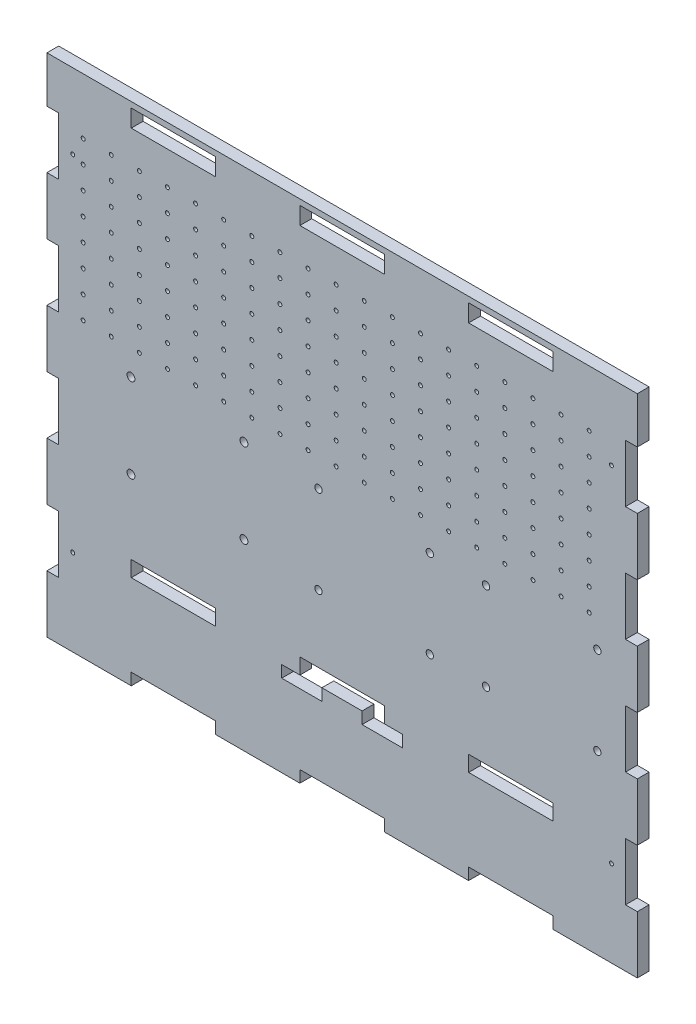
from build123d import *

# Parameters (mm, degrees)
SKETCH1_W                = 266.7
SKETCH1_H                = 223.52
BOSS_EXTRUDE1_DEPTH      = 5.334
SKETCH2_W                = 38.1
SKETCH2_H                = 5.334
CUT_EXTRUDE1_DEPTH       = 197.710659379
SKETCH5_W                = 38.1
SKETCH5_H                = 7.112
CUT_EXTRUDE3_DEPTH       = 197.710659379
SKETCH8_W                = 18.149934459
SKETCH8_H                = 5.334
SKETCH8_W_2              = 18.14993446
CUT_EXTRUDE6_DEPTH       = 197.710659379
SKETCH9_R                = 0.889
CUT_EXTRUDE7_DEPTH       = 197.710659379
SKETCH10_W               = 38.1
SKETCH10_H               = 5.334
BOSS_EXTRUDE2_DEPTH      = 10.16
BOSS_EXTRUDE3_DEPTH      = 76.2
BOSS_EXTRUDE3_DEPTH_BACK = 190.5
SKETCH12_W               = 5.334
SKETCH12_H               = 7.62
SKETCH13_W               = 38.1
SKETCH13_H               = 5.334
BOSS_EXTRUDE4_DEPTH      = 2.54
SKETCH14_W               = 38.1
SKETCH14_H               = 5.334
BOSS_EXTRUDE5_DEPTH      = 2.54
SKETCH15_W               = 38.1
SKETCH15_H               = 5.334
BOSS_EXTRUDE6_DEPTH      = 2.54
SKETCH16_W               = 5.334
SKETCH16_H               = 25.964444445
SKETCH16_H_2             = 25.964444444
CUT_EXTRUDE9_DEPTH       = 205.029793122
SKETCH17_R               = 1.651
CUT_EXTRUDE10_DEPTH      = 205.029793122
SKETCH18_R               = 0.889
CUT_EXTRUDE11_DEPTH      = 205.029793122
SKETCH19_R               = 1.778
CUT_EXTRUDE12_DEPTH      = 205.029793122
SKETCH20_W               = 266.7
SKETCH20_H               = 5.08
CUT_EXTRUDE13_DEPTH      = 205.029793122


with BuildPart() as part:
    # Sketch1 → Boss-Extrude1 (new body)
    with BuildSketch(Plane.XY):
        with Locations((5.474099752, 27.504142138)):
            Rectangle(SKETCH1_W, SKETCH1_H)
    extrude(amount=BOSS_EXTRUDE1_DEPTH)

    # Sketch2 → Cut-Extrude1 (cut, through all)
    with BuildSketch(Plane.XY.offset(5.334)):
        with Locations((-70.725900248, -81.588857862)):
            Rectangle(SKETCH2_W, SKETCH2_H)
        with Locations((5.474099752, -81.588857862)):
            Rectangle(SKETCH2_W, SKETCH2_H)
        with Locations((81.674099752, -81.588857862)):
            Rectangle(SKETCH2_W, SKETCH2_H)
        with Locations((81.674099752, 136.597142138)):
            Rectangle(SKETCH2_W, SKETCH2_H)
        with Locations((5.474099752, 136.597142138)):
            Rectangle(SKETCH2_W, SKETCH2_H)
        with Locations((-70.725900248, 136.597142138)):
            Rectangle(SKETCH2_W, SKETCH2_H)
    extrude(amount=-CUT_EXTRUDE1_DEPTH, mode=Mode.SUBTRACT)

    # Sketch5 → Cut-Extrude3 (cut, through all)
    with BuildSketch(Plane.XY.offset(5.334)):
        with Locations((-70.725900248, -38.378413173)):
            Rectangle(SKETCH5_W, SKETCH5_H)
        with Locations((5.474099752, -38.378413173)):
            Rectangle(SKETCH5_W, SKETCH5_H)
        with Locations((81.674099752, -38.378413173)):
            Rectangle(SKETCH5_W, SKETCH5_H)
    extrude(amount=-CUT_EXTRUDE3_DEPTH, mode=Mode.SUBTRACT)

    # Sketch8 → Cut-Extrude6 (cut, through all)
    with BuildSketch(Plane.XY.offset(5.334)):
        with Locations((-12.722736397, -44.601413173)):
            Rectangle(SKETCH8_W, SKETCH8_H)
        with Locations((23.577132522, -44.601413173)):
            Rectangle(SKETCH8_W_2, SKETCH8_H)
    extrude(amount=-CUT_EXTRUDE6_DEPTH, mode=Mode.SUBTRACT)

    # Sketch9 → Cut-Extrude7 (cut, through all)
    with BuildSketch(Plane.XY.offset(5.334)):
        with Locations((-111.514346632, 118.978930244)):
            Circle(SKETCH9_R)
        with Locations((-98.814346632, 118.978930244)):
            Circle(SKETCH9_R)
        with Locations((-86.114346632, 118.978930244)):
            Circle(SKETCH9_R)
        with Locations((-73.414346632, 118.978930244)):
            Circle(SKETCH9_R)
        with Locations((-60.714346632, 118.978930244)):
            Circle(SKETCH9_R)
        with Locations((-48.014346632, 118.978930244)):
            Circle(SKETCH9_R)
        with Locations((-35.314346632, 118.978930244)):
            Circle(SKETCH9_R)
        with Locations((-22.614346632, 118.978930244)):
            Circle(SKETCH9_R)
        with Locations((-9.914346632, 118.978930244)):
            Circle(SKETCH9_R)
        with Locations((2.785653368, 118.978930244)):
            Circle(SKETCH9_R)
        with Locations((15.485653368, 118.978930244)):
            Circle(SKETCH9_R)
        with Locations((28.185653368, 118.978930244)):
            Circle(SKETCH9_R)
        with Locations((40.885653368, 118.978930244)):
            Circle(SKETCH9_R)
        with Locations((53.585653368, 118.978930244)):
            Circle(SKETCH9_R)
        with Locations((66.285653368, 118.978930244)):
            Circle(SKETCH9_R)
        with Locations((78.985653368, 118.978930244)):
            Circle(SKETCH9_R)
        with Locations((91.685653368, 118.978930244)):
            Circle(SKETCH9_R)
        with Locations((104.385653368, 118.978930244)):
            Circle(SKETCH9_R)
        with Locations((117.085653368, 118.978930244)):
            Circle(SKETCH9_R)
        with Locations((-111.514346632, 108.818930244)):
            Circle(SKETCH9_R)
        with Locations((-98.814346632, 108.818930244)):
            Circle(SKETCH9_R)
        with Locations((-86.114346632, 108.818930244)):
            Circle(SKETCH9_R)
        with Locations((-73.414346632, 108.818930244)):
            Circle(SKETCH9_R)
        with Locations((-60.714346632, 108.818930244)):
            Circle(SKETCH9_R)
        with Locations((-48.014346632, 108.818930244)):
            Circle(SKETCH9_R)
        with Locations((-35.314346632, 108.818930244)):
            Circle(SKETCH9_R)
        with Locations((-22.614346632, 108.818930244)):
            Circle(SKETCH9_R)
        with Locations((-9.914346632, 108.818930244)):
            Circle(SKETCH9_R)
        with Locations((2.785653368, 108.818930244)):
            Circle(SKETCH9_R)
        with Locations((15.485653368, 108.818930244)):
            Circle(SKETCH9_R)
        with Locations((28.185653368, 108.818930244)):
            Circle(SKETCH9_R)
        with Locations((40.885653368, 108.818930244)):
            Circle(SKETCH9_R)
        with Locations((53.585653368, 108.818930244)):
            Circle(SKETCH9_R)
        with Locations((66.285653368, 108.818930244)):
            Circle(SKETCH9_R)
        with Locations((78.985653368, 108.818930244)):
            Circle(SKETCH9_R)
        with Locations((91.685653368, 108.818930244)):
            Circle(SKETCH9_R)
        with Locations((104.385653368, 108.818930244)):
            Circle(SKETCH9_R)
        with Locations((117.085653368, 108.818930244)):
            Circle(SKETCH9_R)
        with Locations((-111.514346632, 98.658930244)):
            Circle(SKETCH9_R)
        with Locations((-98.814346632, 98.658930244)):
            Circle(SKETCH9_R)
        with Locations((-86.114346632, 98.658930244)):
            Circle(SKETCH9_R)
        with Locations((-73.414346632, 98.658930244)):
            Circle(SKETCH9_R)
        with Locations((-60.714346632, 98.658930244)):
            Circle(SKETCH9_R)
        with Locations((-48.014346632, 98.658930244)):
            Circle(SKETCH9_R)
        with Locations((-35.314346632, 98.658930244)):
            Circle(SKETCH9_R)
        with Locations((-22.614346632, 98.658930244)):
            Circle(SKETCH9_R)
        with Locations((-9.914346632, 98.658930244)):
            Circle(SKETCH9_R)
        with Locations((2.785653368, 98.658930244)):
            Circle(SKETCH9_R)
        with Locations((15.485653368, 98.658930244)):
            Circle(SKETCH9_R)
        with Locations((28.185653368, 98.658930244)):
            Circle(SKETCH9_R)
        with Locations((40.885653368, 98.658930244)):
            Circle(SKETCH9_R)
        with Locations((53.585653368, 98.658930244)):
            Circle(SKETCH9_R)
        with Locations((66.285653368, 98.658930244)):
            Circle(SKETCH9_R)
        with Locations((78.985653368, 98.658930244)):
            Circle(SKETCH9_R)
        with Locations((91.685653368, 98.658930244)):
            Circle(SKETCH9_R)
        with Locations((104.385653368, 98.658930244)):
            Circle(SKETCH9_R)
        with Locations((117.085653368, 98.658930244)):
            Circle(SKETCH9_R)
        with Locations((-111.514346632, 88.498930244)):
            Circle(SKETCH9_R)
        with Locations((-98.814346632, 88.498930244)):
            Circle(SKETCH9_R)
        with Locations((-86.114346632, 88.498930244)):
            Circle(SKETCH9_R)
        with Locations((-73.414346632, 88.498930244)):
            Circle(SKETCH9_R)
        with Locations((-60.714346632, 88.498930244)):
            Circle(SKETCH9_R)
        with Locations((-48.014346632, 88.498930244)):
            Circle(SKETCH9_R)
        with Locations((-35.314346632, 88.498930244)):
            Circle(SKETCH9_R)
        with Locations((-22.614346632, 88.498930244)):
            Circle(SKETCH9_R)
        with Locations((-9.914346632, 88.498930244)):
            Circle(SKETCH9_R)
        with Locations((2.785653368, 88.498930244)):
            Circle(SKETCH9_R)
        with Locations((15.485653368, 88.498930244)):
            Circle(SKETCH9_R)
        with Locations((28.185653368, 88.498930244)):
            Circle(SKETCH9_R)
        with Locations((40.885653368, 88.498930244)):
            Circle(SKETCH9_R)
        with Locations((53.585653368, 88.498930244)):
            Circle(SKETCH9_R)
        with Locations((66.285653368, 88.498930244)):
            Circle(SKETCH9_R)
        with Locations((78.985653368, 88.498930244)):
            Circle(SKETCH9_R)
        with Locations((91.685653368, 88.498930244)):
            Circle(SKETCH9_R)
        with Locations((104.385653368, 88.498930244)):
            Circle(SKETCH9_R)
        with Locations((117.085653368, 88.498930244)):
            Circle(SKETCH9_R)
        with Locations((-111.514346632, 78.338930244)):
            Circle(SKETCH9_R)
        with Locations((-98.814346632, 78.338930244)):
            Circle(SKETCH9_R)
        with Locations((-86.114346632, 78.338930244)):
            Circle(SKETCH9_R)
        with Locations((-73.414346632, 78.338930244)):
            Circle(SKETCH9_R)
        with Locations((-60.714346632, 78.338930244)):
            Circle(SKETCH9_R)
        with Locations((-48.014346632, 78.338930244)):
            Circle(SKETCH9_R)
        with Locations((-35.314346632, 78.338930244)):
            Circle(SKETCH9_R)
        with Locations((-22.614346632, 78.338930244)):
            Circle(SKETCH9_R)
        with Locations((-9.914346632, 78.338930244)):
            Circle(SKETCH9_R)
        with Locations((2.785653368, 78.338930244)):
            Circle(SKETCH9_R)
        with Locations((15.485653368, 78.338930244)):
            Circle(SKETCH9_R)
        with Locations((28.185653368, 78.338930244)):
            Circle(SKETCH9_R)
        with Locations((40.885653368, 78.338930244)):
            Circle(SKETCH9_R)
        with Locations((53.585653368, 78.338930244)):
            Circle(SKETCH9_R)
        with Locations((66.285653368, 78.338930244)):
            Circle(SKETCH9_R)
        with Locations((78.985653368, 78.338930244)):
            Circle(SKETCH9_R)
        with Locations((91.685653368, 78.338930244)):
            Circle(SKETCH9_R)
        with Locations((104.385653368, 78.338930244)):
            Circle(SKETCH9_R)
        with Locations((117.085653368, 78.338930244)):
            Circle(SKETCH9_R)
        with Locations((-111.514346632, 68.178930244)):
            Circle(SKETCH9_R)
        with Locations((-98.814346632, 68.178930244)):
            Circle(SKETCH9_R)
        with Locations((-86.114346632, 68.178930244)):
            Circle(SKETCH9_R)
        with Locations((-73.414346632, 68.178930244)):
            Circle(SKETCH9_R)
        with Locations((-60.714346632, 68.178930244)):
            Circle(SKETCH9_R)
        with Locations((-48.014346632, 68.178930244)):
            Circle(SKETCH9_R)
        with Locations((-35.314346632, 68.178930244)):
            Circle(SKETCH9_R)
        with Locations((-22.614346632, 68.178930244)):
            Circle(SKETCH9_R)
        with Locations((-9.914346632, 68.178930244)):
            Circle(SKETCH9_R)
        with Locations((2.785653368, 68.178930244)):
            Circle(SKETCH9_R)
        with Locations((15.485653368, 68.178930244)):
            Circle(SKETCH9_R)
        with Locations((28.185653368, 68.178930244)):
            Circle(SKETCH9_R)
        with Locations((40.885653368, 68.178930244)):
            Circle(SKETCH9_R)
        with Locations((53.585653368, 68.178930244)):
            Circle(SKETCH9_R)
        with Locations((66.285653368, 68.178930244)):
            Circle(SKETCH9_R)
        with Locations((78.985653368, 68.178930244)):
            Circle(SKETCH9_R)
        with Locations((91.685653368, 68.178930244)):
            Circle(SKETCH9_R)
        with Locations((104.385653368, 68.178930244)):
            Circle(SKETCH9_R)
        with Locations((117.085653368, 68.178930244)):
            Circle(SKETCH9_R)
        with Locations((-111.514346632, 58.018930244)):
            Circle(SKETCH9_R)
        with Locations((-98.814346632, 58.018930244)):
            Circle(SKETCH9_R)
        with Locations((-86.114346632, 58.018930244)):
            Circle(SKETCH9_R)
        with Locations((-73.414346632, 58.018930244)):
            Circle(SKETCH9_R)
        with Locations((-60.714346632, 58.018930244)):
            Circle(SKETCH9_R)
        with Locations((-48.014346632, 58.018930244)):
            Circle(SKETCH9_R)
        with Locations((-35.314346632, 58.018930244)):
            Circle(SKETCH9_R)
        with Locations((-22.614346632, 58.018930244)):
            Circle(SKETCH9_R)
        with Locations((-9.914346632, 58.018930244)):
            Circle(SKETCH9_R)
        with Locations((2.785653368, 58.018930244)):
            Circle(SKETCH9_R)
        with Locations((15.485653368, 58.018930244)):
            Circle(SKETCH9_R)
        with Locations((28.185653368, 58.018930244)):
            Circle(SKETCH9_R)
        with Locations((40.885653368, 58.018930244)):
            Circle(SKETCH9_R)
        with Locations((53.585653368, 58.018930244)):
            Circle(SKETCH9_R)
        with Locations((66.285653368, 58.018930244)):
            Circle(SKETCH9_R)
        with Locations((78.985653368, 58.018930244)):
            Circle(SKETCH9_R)
        with Locations((91.685653368, 58.018930244)):
            Circle(SKETCH9_R)
        with Locations((104.385653368, 58.018930244)):
            Circle(SKETCH9_R)
        with Locations((117.085653368, 58.018930244)):
            Circle(SKETCH9_R)
        with Locations((-111.514346632, 47.858930244)):
            Circle(SKETCH9_R)
        with Locations((-98.814346632, 47.858930244)):
            Circle(SKETCH9_R)
        with Locations((-86.114346632, 47.858930244)):
            Circle(SKETCH9_R)
        with Locations((-73.414346632, 47.858930244)):
            Circle(SKETCH9_R)
        with Locations((-60.714346632, 47.858930244)):
            Circle(SKETCH9_R)
        with Locations((-48.014346632, 47.858930244)):
            Circle(SKETCH9_R)
        with Locations((-35.314346632, 47.858930244)):
            Circle(SKETCH9_R)
        with Locations((-22.614346632, 47.858930244)):
            Circle(SKETCH9_R)
        with Locations((-9.914346632, 47.858930244)):
            Circle(SKETCH9_R)
        with Locations((2.785653368, 47.858930244)):
            Circle(SKETCH9_R)
        with Locations((15.485653368, 47.858930244)):
            Circle(SKETCH9_R)
        with Locations((28.185653368, 47.858930244)):
            Circle(SKETCH9_R)
        with Locations((40.885653368, 47.858930244)):
            Circle(SKETCH9_R)
        with Locations((53.585653368, 47.858930244)):
            Circle(SKETCH9_R)
        with Locations((66.285653368, 47.858930244)):
            Circle(SKETCH9_R)
        with Locations((78.985653368, 47.858930244)):
            Circle(SKETCH9_R)
        with Locations((91.685653368, 47.858930244)):
            Circle(SKETCH9_R)
        with Locations((104.385653368, 47.858930244)):
            Circle(SKETCH9_R)
        with Locations((117.085653368, 47.858930244)):
            Circle(SKETCH9_R)
    extrude(amount=-CUT_EXTRUDE7_DEPTH, mode=Mode.SUBTRACT)

    # Sketch10 → Boss-Extrude2 (add)
    with BuildSketch(Plane(origin=(0, 139.264142138, 0), x_dir=(1, 0, 0), z_dir=(0, 1, 0))):
        with Locations((-32.625900248, -2.667)):
            Rectangle(SKETCH10_W, SKETCH10_H)
    extrude(amount=BOSS_EXTRUDE2_DEPTH)

    # Sketch12 → Boss-Extrude3 (add, two sides: drawn at the far end of the back side and taken through both)
    with BuildSketch(Plane.ZY.offset(51.675900248).offset(-BOSS_EXTRUDE3_DEPTH_BACK)):
        with Locations((2.667, 145.614142138)):
            Rectangle(SKETCH12_W, SKETCH12_H)
    extrude(amount=BOSS_EXTRUDE3_DEPTH + BOSS_EXTRUDE3_DEPTH_BACK)

    # Sketch13 → Boss-Extrude4 (add)
    with BuildSketch(Plane(origin=(0, 139.264142138, 0), x_dir=(1, 0, 0), z_dir=(0, 1, 0))):
        with Locations((-108.825900248, -2.667)):
            Rectangle(SKETCH13_W, SKETCH13_H)
    extrude(amount=BOSS_EXTRUDE4_DEPTH)

    # Sketch14 → Boss-Extrude5 (add)
    with BuildSketch(Plane(origin=(0, 139.264142138, 0), x_dir=(1, 0, 0), z_dir=(0, 1, 0))):
        with Locations((43.574099752, -2.667)):
            Rectangle(SKETCH14_W, SKETCH14_H)
    extrude(amount=BOSS_EXTRUDE5_DEPTH)

    # Sketch15 → Boss-Extrude6 (add)
    with BuildSketch(Plane(origin=(0, 139.264142138, 0), x_dir=(1, 0, 0), z_dir=(0, 1, 0))):
        with Locations((119.774099752, -2.667)):
            Rectangle(SKETCH15_W, SKETCH15_H)
    extrude(amount=BOSS_EXTRUDE6_DEPTH)

    # Sketch16 → Cut-Extrude9 (cut, through all)
    with BuildSketch(Plane.XY.offset(5.334)):
        with Locations((-125.208900248, -45.309191196)):
            Rectangle(SKETCH16_W, SKETCH16_H)
        with Locations((-125.208900248, 6.619697693)):
            Rectangle(SKETCH16_W, SKETCH16_H)
        with Locations((-125.208900248, 58.548586582)):
            Rectangle(SKETCH16_W, SKETCH16_H_2)
        with Locations((-125.208900248, 110.477475471)):
            Rectangle(SKETCH16_W, SKETCH16_H_2)
        with Locations((136.157099752, 110.477475471)):
            Rectangle(SKETCH16_W, SKETCH16_H_2)
        with Locations((136.157099752, 58.548586582)):
            Rectangle(SKETCH16_W, SKETCH16_H_2)
        with Locations((136.157099752, 6.619697693)):
            Rectangle(SKETCH16_W, SKETCH16_H)
        with Locations((136.157099752, -45.309191196)):
            Rectangle(SKETCH16_W, SKETCH16_H)
    extrude(amount=-CUT_EXTRUDE9_DEPTH, mode=Mode.SUBTRACT)

    # Sketch17 → Cut-Extrude10 (cut, through all)
    with BuildSketch(Plane.XY.offset(5.334)):
        with Locations((120.790099752, 35.158930244)):
            Circle(SKETCH17_R)
        with Locations((70.498099752, 35.158930244)):
            Circle(SKETCH17_R)
        with Locations((70.498099752, -4.465069756)):
            Circle(SKETCH17_R)
        with Locations((120.790099752, -4.465069756)):
            Circle(SKETCH17_R)
        with Locations((45.098099752, 35.158930244)):
            Circle(SKETCH17_R)
        with Locations((-5.193900248, 35.158930244)):
            Circle(SKETCH17_R)
        with Locations((-5.193900248, -4.465069756)):
            Circle(SKETCH17_R)
        with Locations((45.098099752, -4.465069756)):
            Circle(SKETCH17_R)
    extrude(amount=-CUT_EXTRUDE10_DEPTH, mode=Mode.SUBTRACT)

    # Sketch18 → Cut-Extrude11 (cut, through all)
    with BuildSketch(Plane.XY.offset(5.334)):
        with Locations((127.140099752, 110.477475471)):
            Circle(SKETCH18_R)
        with Locations((-116.191900248, 110.477475471)):
            Circle(SKETCH18_R)
        with Locations((-116.191900248, -45.309191196)):
            Circle(SKETCH18_R)
        with Locations((127.140099752, -45.309191196)):
            Circle(SKETCH18_R)
    extrude(amount=-CUT_EXTRUDE11_DEPTH, mode=Mode.SUBTRACT)

    # Sketch19 → Cut-Extrude12 (cut, through all)
    with BuildSketch(Plane(origin=(0, 0, 0), x_dir=(-1, 0, 0), z_dir=(0, 0, -1))):
        with Locations((89.902900248, 36.555930244)):
            Circle(SKETCH19_R)
        with Locations((89.902900248, -1.544069756)):
            Circle(SKETCH19_R)
        with Locations((38.848900248, -1.544069756)):
            Circle(SKETCH19_R)
        with Locations((38.848900248, 36.555930244)):
            Circle(SKETCH19_R)
    extrude(amount=-CUT_EXTRUDE12_DEPTH, mode=Mode.SUBTRACT)

    # Sketch20 → Cut-Extrude13 (cut, through all)
    with BuildSketch(Plane.XY.offset(5.334)):
        with Locations((5.474099752, 146.884142138)):
            Rectangle(SKETCH20_W, SKETCH20_H)
    extrude(amount=-CUT_EXTRUDE13_DEPTH, mode=Mode.SUBTRACT)


solid = part.part
